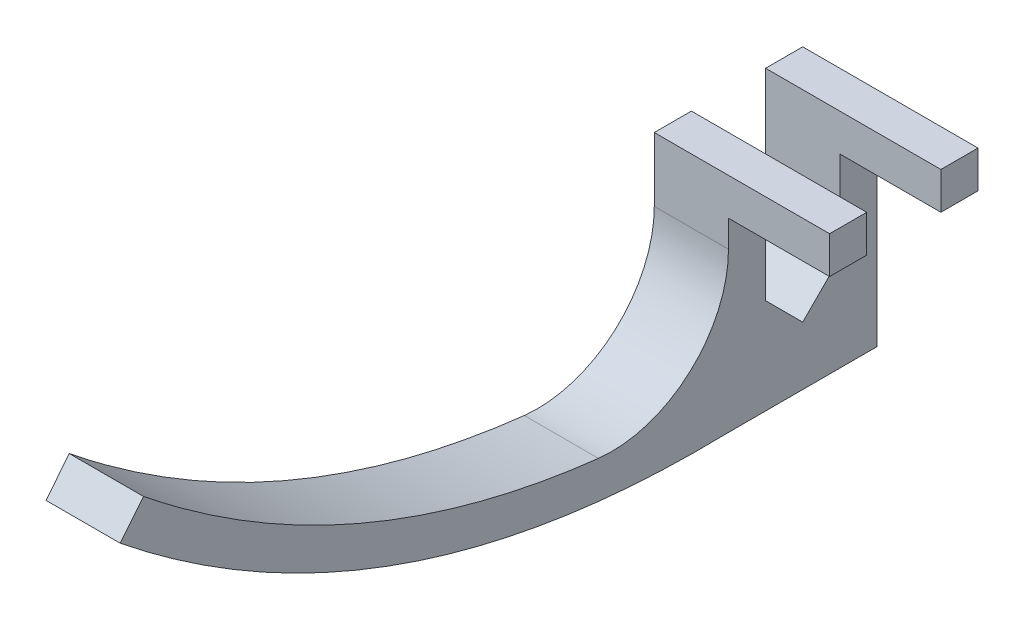
from build123d import *

# Parameters (mm, degrees)
BOSS_EXTRUDE1_DEPTH = 12.7
EXTRUDE_THIN1_START = -6.35
EXTRUDE_THIN1_DEPTH = 12.7
BOSS_EXTRUDE2_DEPTH = 12.7
SKETCH4_W           = 6.35
SKETCH4_H           = 6.35
BOSS_EXTRUDE3_DEPTH = 17.3
FILLET1_R           = 20
CHAMFER1_SIZE       = 10


# Read off the part's stored shape, not the designer's step: Extrude-Thin1
with BuildPart() as part:
    # Sketch1 → Boss-Extrude1 (new body)
    with BuildSketch(Plane(origin=(0, 0, 0), x_dir=(0, 0, -1), z_dir=(1, 0, 0))):
        Polygon((72.847962895, 3.175), (72.847962895, 0), (98.247962895, 0), (98.247962895, 38.1), (91.897962895, 38.1), (91.897962895, 6.35), (79.197962895, 6.35), (79.197962895, 38.1), (72.847962895, 38.1), align=None)
    extrude(amount=BOSS_EXTRUDE1_DEPTH)



with BuildPart() as body_2:
    # Extrude-Thin1 outline → Extrude-Thin1 (new body)
    with BuildSketch(Plane(origin=(6.35, 0, 0), x_dir=(0, 0, -1), z_dir=(1, 0, 0)).offset(EXTRUDE_THIN1_START)):
        with BuildLine():
            Line((72.417611424, 0.000950446), (72.262248261, 6.349049554))
            add(Edge.make_bspline(
                [(72.262248261, 6.349049554), (63.021883212, 6.122901173), (54.028914036, 6.667445615), (36.522694485, 9.291097632), (28.009187017, 11.370086401), (11.442378767, 17.064926737), (3.388803369, 20.680920683), (-12.273002956, 29.461644656), (-19.881272632, 34.626626552), (-27.26926203, 40.573319228)],
                knots=[0, 0, 0, 0, 0.25, 0.25, 0.5, 0.5, 0.75, 0.75, 1, 1, 1, 1], degree=3))
            Line((-27.26926203, 40.573319228), (-31.250878284, 35.626680772))
            add(Edge.make_bspline(
                [(72.417611424, 0.000950446), (62.82712633, -0.233766762), (53.463624565, 0.331247938), (35.205660639, 3.067563666), (26.31145557, 5.238983498), (9.011597154, 11.185809829), (0.606218421, 14.961073948), (-15.70112511, 24.103715563), (-23.603051159, 29.470841193), (-31.250878284, 35.626680772)],
                knots=[0, 0, 0, 0, 0.25, 0.25, 0.5, 0.5, 0.75, 0.75, 1, 1, 1, 1], degree=3))
        make_face()
    extrude(amount=EXTRUDE_THIN1_DEPTH)


with BuildPart() as part_1:
    add(part.part)

    add(body_2.part)  # Boss-Extrude2 merges body 2
    # Sketch3 → Boss-Extrude2 (add)
    with BuildSketch(Plane(origin=(12.7, 0, 0), x_dir=(0, 0, -1), z_dir=(1, 0, 0))):
        Polygon((72.262248261, 6.349049554), (72.847962895, 6.349049554), (72.847962895, 0), (72.417611424, 0.000950446), align=None)
    extrude(amount=-BOSS_EXTRUDE2_DEPTH)

    # Sketch4 → Boss-Extrude3 (add)
    with BuildSketch(Plane(origin=(12.7, 0, 0), x_dir=(0, 0, -1), z_dir=(1, 0, 0))):
        with Locations((76.022962895, 34.925)):
            Rectangle(SKETCH4_W, SKETCH4_H)
        with Locations((95.072962895, 34.925)):
            Rectangle(SKETCH4_W, SKETCH4_H)
    extrude(amount=BOSS_EXTRUDE3_DEPTH)

    # Fillet1
    fillet1_edges = [part_1.edges().sort_by_distance(p)[0] for p in [
        (6.35, 6.349049554, -72.847962895),
    ]]
    fillet(fillet1_edges, radius=FILLET1_R)

    # Chamfer1
    # the kernel refuses this chamfer: 10 mm, written as the material it adds along each edge
    with BuildSketch(Plane(origin=(0, 6.35, -91.897962895), x_dir=(0, -0.027495876610586664, 0.9996219169112968), z_dir=(1, 0, 0)), Plane(origin=(0, 6.35, -79.197962895), x_dir=(0, 0.9996219169112968, 0.027495876610586317), z_dir=(1, 0, 0))) as chamfer1_piece_1:
        Polygon((CHAMFER1_SIZE * 0.999621916911, -CHAMFER1_SIZE * 0.0274958766106), (-CHAMFER1_SIZE * 0.0274958766106, -CHAMFER1_SIZE * 0.999621916911), (0, 0), align=None)
    extrude(amount=12.7)


solid = part_1.part
